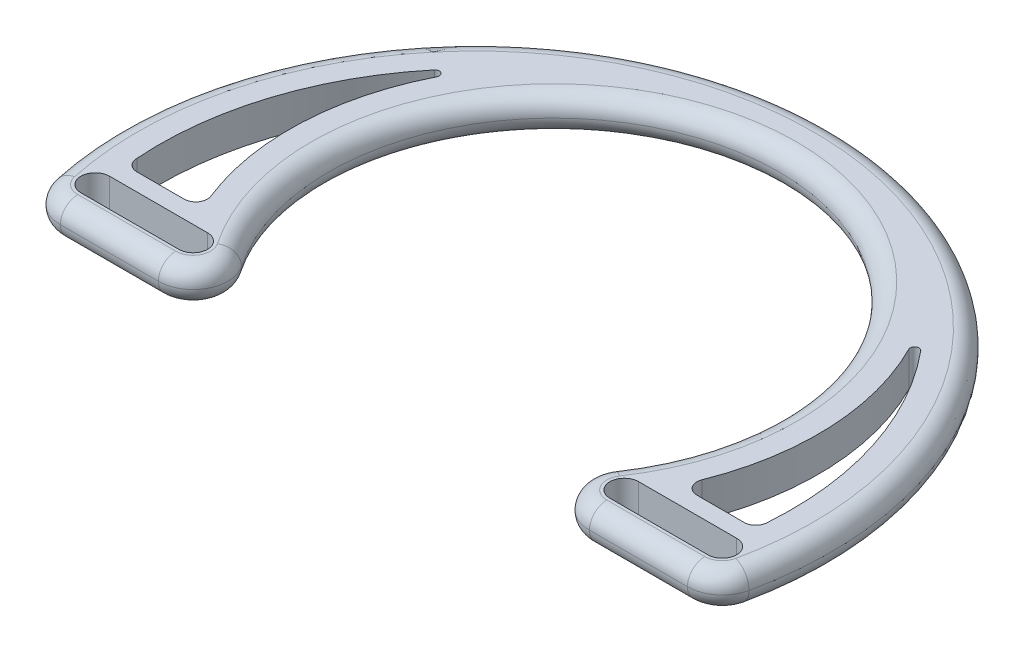
from build123d import *

# Parameters (mm, degrees)
EXTRUDE_1_DEPTH     = 4
FILLET_1_R          = 2
CUT_EXTRUDE_2_DEPTH = 64.492631813


with BuildPart() as part:
    # 草图2 → 凸台-拉伸1 (new body)
    with BuildSketch(Plane(origin=(0, 0, 0), x_dir=(1, 0, 0), z_dir=(0, 1, 0))):
        with BuildLine():
            Line((-24.75, -4), (-36, -4))
            ThreePointArc((-36, -4), (-38.516568808, -3.109160889), (-39.912208656, -0.833440718))
            ThreePointArc((-39.912208656, -0.833440718), (0, 48.477143514), (39.912208656, -0.833440718))
            ThreePointArc((39.912208656, -0.833440718), (38.516568808, -3.109160889), (36, -4))
            Line((36, -4), (24.75, -4))
            ThreePointArc((24.75, -4), (21.21885665, -1.879102616), (21.432309646, 2.234486679))
            ThreePointArc((21.432309646, 2.234486679), (0, 42.509326923), (-21.432309646, 2.234486679))
            ThreePointArc((-21.432309646, 2.234486679), (-21.21885665, -1.879102616), (-24.75, -4))
        make_face()
        with BuildLine():
            Line((-36, 1.65), (-24.75, 1.65))
            ThreePointArc((-24.75, 1.65), (-23.1, 0), (-24.75, -1.65))
            Line((-24.75, -1.65), (-36, -1.65))
            ThreePointArc((-36, -1.65), (-37.65, 0), (-36, 1.65))
        make_face(mode=Mode.SUBTRACT)
        with BuildLine():
            Line((36, 1.65), (24.75, 1.65))
            ThreePointArc((24.75, 1.65), (23.1, 0), (24.75, -1.65))
            Line((24.75, -1.65), (36, -1.65))
            ThreePointArc((36, -1.65), (37.65, 0), (36, 1.65))
        make_face(mode=Mode.SUBTRACT)
    extrude(amount=EXTRUDE_1_DEPTH)

    # 圆角1
    fillet_1_edges = [part.edges().sort_by_distance(p)[0] for p in [
        (-38.516568808, 0, 3.109160889),
        (0, 0, -48.477143514),
        (38.516568808, 0, 3.109160889),
        (30.375, 0, 4),
        (21.21885665, 0, 1.879102616),
        (0, 0, -42.509326923),
        (-21.21885665, 0, 1.879102616),
        (-21.21885665, 4, 1.879102616),
        (-30.375, 4, 4),
        (-38.516568808, 4, 3.109160889),
        (0, 4, -48.477143514),
        (38.516568808, 4, 3.109160889),
        (30.375, 4, 4),
        (21.21885665, 4, 1.879102616),
        (-30.375, 0, 4),
        (0, 4, -42.509326923),
    ]]
    fillet(fillet_1_edges, radius=FILLET_1_R - 0.0001)  # a hair under: the kernel refuses the full size

    # 草图4 → 切除-拉伸2 (cut, through all)
    with BuildSketch(Plane(origin=(0, 4, 0), x_dir=(1, 0, 0), z_dir=(0, 1, 0))):
        with BuildLine():
            Line((-34.872154706, 3.65), (-29.437290433, 3.65))
            ThreePointArc((-29.437290433, 3.65), (-28.334992254, 4.233967388), (-28.198977603, 5.473959002))
            ThreePointArc((-28.198977603, 5.473959002), (-30.310084994, 18.017081432), (-27.0940075, 30.323321324))
            ThreePointArc((-27.0940075, 30.323321324), (-27.266499401, 30.966568064), (-27.925113784, 30.867841575))
            ThreePointArc((-27.925113784, 30.867841575), (-34.578408784, 18.729054984), (-36.204488684, 4.982333979))
            ThreePointArc((-36.204488684, 4.982333979), (-35.814257097, 4.040231588), (-34.872154706, 3.65))
        make_face()
    cut_extrude_2 = extrude(amount=-CUT_EXTRUDE_2_DEPTH, mode=Mode.SUBTRACT)

    # 镜向1: 切除-拉伸2 across plane
    add(cut_extrude_2.mirror(Plane(origin=(0, 0, 0), x_dir=(0, 0, 1), z_dir=(1, 0, 0))), mode=Mode.SUBTRACT)


solid = part.part
